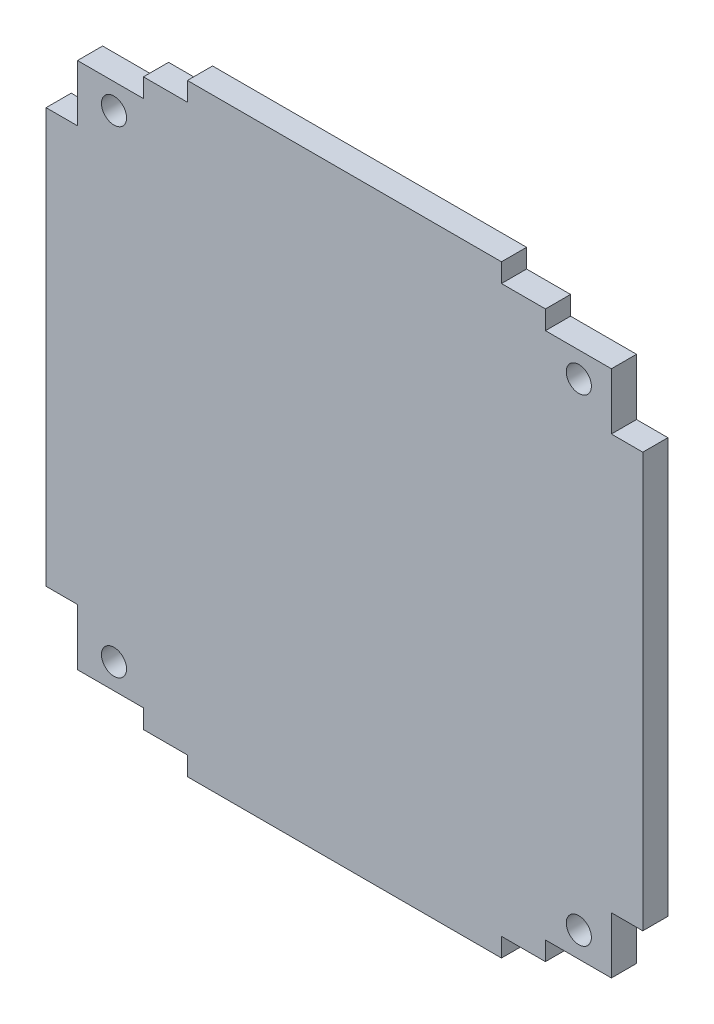
from build123d import *

# Parameters (mm, degrees)
BOSS_EXTRUDE1_DEPTH = 4
SKETCH2_R           = 2
SKETCH2_R_2         = 1.999999999
CUT_EXTRUDE1_DEPTH  = 10


with BuildPart() as part:
    # Sketch1 → Boss-Extrude1 (new body)
    with BuildSketch(Plane.XY):
        Polygon((-47.81401419, 32.999996484), (-42.81401419, 32.999996674), (-42.814014531, 41.999996674), (-32.314014531, 41.999997072), (-32.314014645, 44.999997072), (-25.314014645, 44.999997337), (-25.314014759, 47.999997337), (24.685985241, 47.999999233), (24.685985355, 44.999999233), (31.685985355, 44.999999498), (31.685985469, 41.999999498), (42.185985469, 41.999999896), (42.18598581, 32.999999896), (47.18598581, 33.000000086), (47.185988312, -32.999999914), (42.18598581, -32.999999896), (42.185985469, -41.999999896), (31.685985469, -41.999999498), (31.685985355, -44.999999498), (24.685985355, -44.999999233), (24.685985241, -47.999999233), (-25.314014759, -47.999997337), (-25.314014645, -44.999997337), (-32.314014645, -44.999997072), (-32.314014531, -41.999997072), (-42.814014531, -41.999996674), (-42.81401419, -32.999996674), (-47.81401419, -32.999996484), align=None)
    extrude(amount=BOSS_EXTRUDE1_DEPTH)

    # Sketch2 → Cut-Extrude1 (cut)
    with BuildSketch(Plane.XY.offset(4)):
        with Locations((-37.000054531, 38.000043394)):
            Circle(SKETCH2_R)
        with Locations((36.999973508, 37.999999998)):
            Circle(SKETCH2_R)
        with Locations((-36.99997351, -37.999999915)):
            Circle(SKETCH2_R)
        with Locations((37.00005453, -38.000043311)):
            Circle(SKETCH2_R_2)
    extrude(amount=-CUT_EXTRUDE1_DEPTH, mode=Mode.SUBTRACT)


solid = part.part
